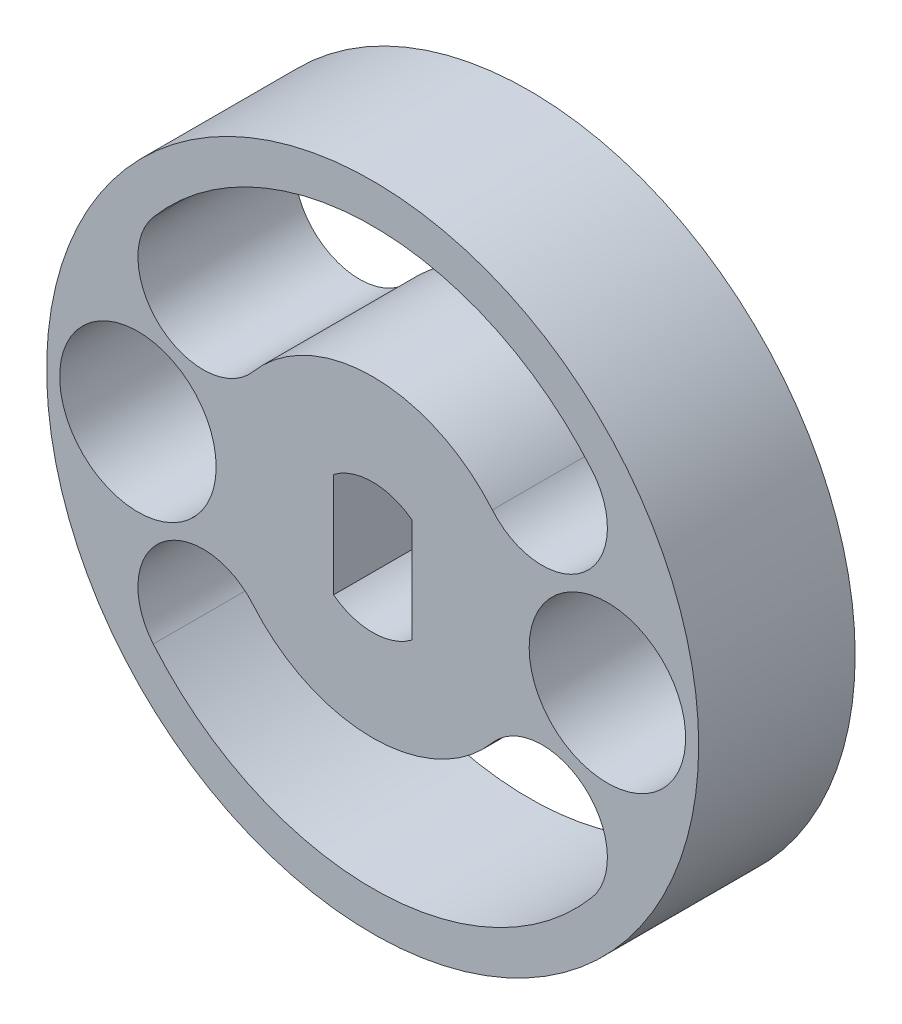
from build123d import *
from build123d.topology import SkipClean

# Parameters (mm, degrees)
BOSS_EXTRUDE1_DEPTH = 6000
CUT_EXTRUDE1_DEPTH  = 18669.154702594


with BuildPart() as part:
    # Sketch1 → Boss-Extrude1 (new body)
    with BuildSketch(Plane.XY):
        with BuildLine():
            Line((1500, 2000), (1500, 0))
            Line((1500, 0), (6000, 0))
            ThreePointArc((6000, 0), (9000, 3000), (12000, 0))
            Line((12000, 0), (12500, 0))
            ThreePointArc((12500, 0), (8838.834764832, 8838.834764832), (0, 12500))
            Line((0, 12500), (0, 2500))
            ThreePointArc((0, 2500), (790.569415042, 2371.708245126), (1500, 2000))
        make_face()
    extrude(amount=BOSS_EXTRUDE1_DEPTH)

    # Mirror4: part across plane


with BuildPart() as part_1:
    add(part.part)
    add(part.part.mirror(Plane(origin=(0, 12500, 6000), x_dir=(0, 0, 1), z_dir=(1, 0, 0))))

    # Sketch2 → Cut-Extrude1 (cut, through all)
    with BuildSketch(Plane.XY.offset(6000)):
        with BuildLine():
            ThreePointArc((8411.764705882, 7088.174273596), (0, 11000), (-8411.764705882, 7088.174273596))
            ThreePointArc((-8411.764705882, 7088.174273596), (-8110.948698545, 3565.460869169), (-4588.235294118, 3866.276876507))
            ThreePointArc((-4588.235294118, 3866.276876507), (0, 6000), (4588.235294118, 3866.276876507))
            ThreePointArc((4588.235294118, 3866.276876507), (8110.948698545, 3565.460869169), (8411.764705882, 7088.174273596))
        make_face()
    extrude(amount=-CUT_EXTRUDE1_DEPTH, mode=Mode.SUBTRACT)

    # Mirror5: part across plane


with BuildPart() as part_2:
    with SkipClean():  # the faces are left unmerged after this step: merging them gives an invalid solid
        add(part_1.part)
        add(part_1.part.mirror(Plane(origin=(-1500, 0, 6000), x_dir=(0, 0, 1), z_dir=(0, 1, 0))))


solid = part_2.part
